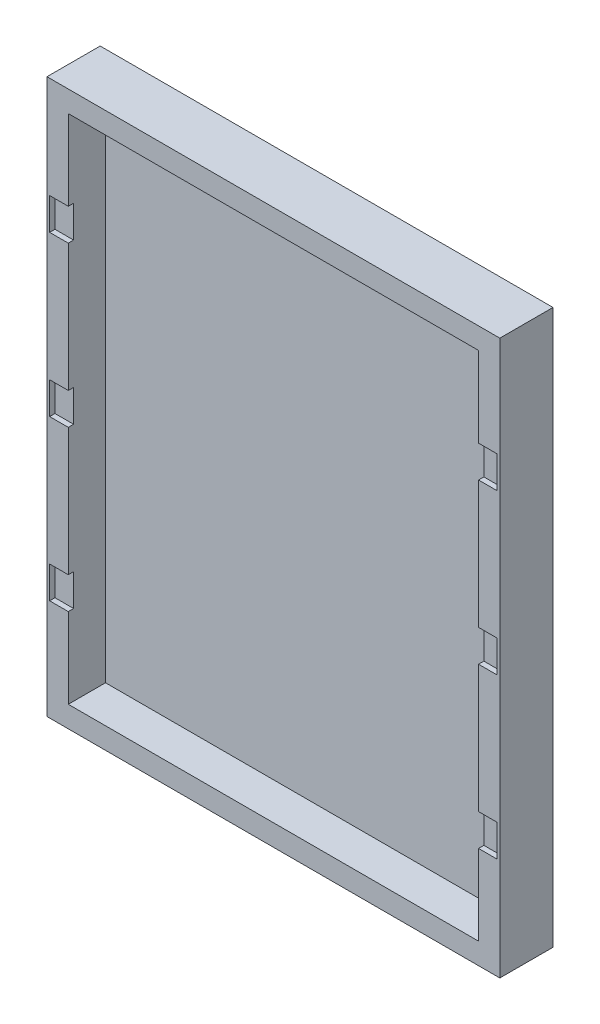
from build123d import *

# Parameters (mm, degrees)
MODEL_W             = 85.14935
MODEL_H             = 104.19946
MODEL_W_2           = 77.14935
MODEL_H_2           = 96.19946
EXTRUDE_2_DEPTH     = 7
SKETCH_1_W          = 85.14935
SKETCH_1_H          = 104.19946
EXTRUDE_3_DEPTH     = 3
SKETCH_2_W          = 3.5
SKETCH_2_H          = 6
CUT_EXTRUDE_1_DEPTH = 1


with BuildPart() as part:
    # Model → 凸台-拉伸2 (new body)
    with BuildSketch(Plane.XY):
        with Locations((38.194325, 47.88337)):
            Rectangle(MODEL_W, MODEL_H)
        with Locations((38.194325, 47.88337)):
            Rectangle(MODEL_W_2, MODEL_H_2, mode=Mode.SUBTRACT)
    extrude(amount=EXTRUDE_2_DEPTH)

    # 草图1 → 凸台-拉伸3 (add)
    with BuildSketch(Plane(origin=(0, 0, 0), x_dir=(-1, 0, 0), z_dir=(0, 0, -1))):
        with Locations((-38.194325, 47.88337)):
            Rectangle(SKETCH_1_W, SKETCH_1_H)
    extrude(amount=EXTRUDE_3_DEPTH)

    # 草图2 → 切除-拉伸1 (cut)
    with BuildSketch(Plane.XY.offset(7)):
        with Locations((-2.13035, 77.88337)):
            Rectangle(SKETCH_2_W, SKETCH_2_H)
        with Locations((78.519, 77.88337)):
            Rectangle(SKETCH_2_W, SKETCH_2_H)
        with Locations((-2.13035, 47.88337)):
            Rectangle(SKETCH_2_W, SKETCH_2_H)
        with Locations((78.519, 47.88337)):
            Rectangle(SKETCH_2_W, SKETCH_2_H)
        with Locations((-2.13035, 17.88337)):
            Rectangle(SKETCH_2_W, SKETCH_2_H)
        with Locations((78.519, 17.88337)):
            Rectangle(SKETCH_2_W, SKETCH_2_H)
    extrude(amount=-CUT_EXTRUDE_1_DEPTH, mode=Mode.SUBTRACT)


solid = part.part
